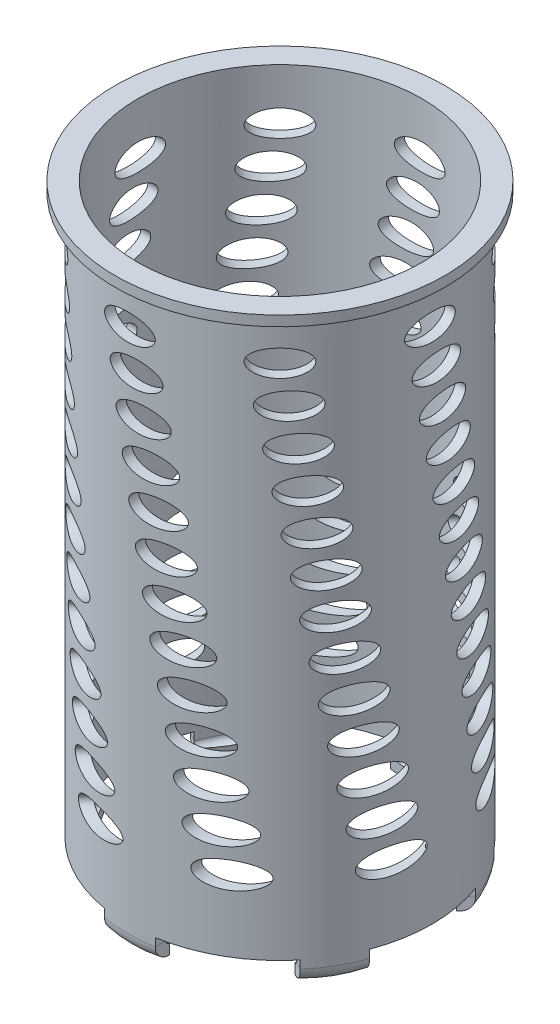
from build123d import *
from build123d.topology import SkipClean

# Parameters (mm, degrees)
CUT_EXTRUDE1_REACH      = 90.565
CUT_EXTRUDE1_END_RADIUS = 17.78
SKETCH3_RX              = 3.175
SKETCH3_RY              = 1.651
CIRPATTERN1_COUNT       = 8
CIRPATTERN2_COUNT       = 6


with BuildPart() as part:
    # Sketch2 → Revolve-Thin1 (revolve)
    with BuildSketch(Plane(origin=(0, 0, 0), x_dir=(0, 0, -1), z_dir=(1, 0, 0)), mode=Mode.PRIVATE) as revolve_thin1_sk:
        Polygon((-19.05, 0), (-19.05, 69.85), (-20.6375, 69.85), (-20.6375, 71.12), (-17.78, 71.12), (-17.78, 0), align=None)
    revolve(revolve_thin1_sk.sketch.rotate(Axis((0, 0, 0), (0, 1, 0)), 180), axis=Axis((0, 0, 0), (0, 1, 0)))

    # Cut-Extrude1: up to this cylinder (the profile starts outside it)
    cut_extrude1_end = Plane(origin=(0, 36.83, 0), z_dir=(0, -1, 0)) * Cylinder(CUT_EXTRUDE1_END_RADIUS, 273.57, mode=Mode.PRIVATE)
    # Sketch3 → Cut-Extrude1 (cut, up to the surface)
    with BuildSketch(Plane.XY.offset(27.94), mode=Mode.PRIVATE) as cut_extrude1_sk1:
        with Locations((0, 64.77)):
            Ellipse(SKETCH3_RX, SKETCH3_RY)
    cut_extrude1_tool1 = extrude(cut_extrude1_sk1.sketch, amount=-CUT_EXTRUDE1_REACH, mode=Mode.PRIVATE) - cut_extrude1_end
    # Sketch3 → Cut-Extrude1 (cut, up to the surface)
    with BuildSketch(Plane.XY.offset(27.94), mode=Mode.PRIVATE) as cut_extrude1_sk2:
        with Locations((0.821095973, 60.113333333)):
            Ellipse(SKETCH3_RX, SKETCH3_RY)
    cut_extrude1_tool2 = extrude(cut_extrude1_sk2.sketch, amount=-CUT_EXTRUDE1_REACH, mode=Mode.PRIVATE) - cut_extrude1_end
    # Sketch3 → Cut-Extrude1 (cut, up to the surface)
    with BuildSketch(Plane.XY.offset(27.94), mode=Mode.PRIVATE) as cut_extrude1_sk3:
        with Locations(Location((1.642191947, 55.456666667), (0, 0, 180))):
            Ellipse(SKETCH3_RX, SKETCH3_RY)
    cut_extrude1_tool3 = extrude(cut_extrude1_sk3.sketch, amount=-CUT_EXTRUDE1_REACH, mode=Mode.PRIVATE) - cut_extrude1_end
    # Sketch3 → Cut-Extrude1 (cut, up to the surface)
    with BuildSketch(Plane.XY.offset(27.94), mode=Mode.PRIVATE) as cut_extrude1_sk4:
        with Locations((2.46328792, 50.8)):
            Ellipse(SKETCH3_RX, SKETCH3_RY)
    cut_extrude1_tool4 = extrude(cut_extrude1_sk4.sketch, amount=-CUT_EXTRUDE1_REACH, mode=Mode.PRIVATE) - cut_extrude1_end
    # Sketch3 → Cut-Extrude1 (cut, up to the surface)
    with BuildSketch(Plane.XY.offset(27.94), mode=Mode.PRIVATE) as cut_extrude1_sk5:
        with Locations((3.284383894, 46.143333333)):
            Ellipse(SKETCH3_RX, SKETCH3_RY)
    cut_extrude1_tool5 = extrude(cut_extrude1_sk5.sketch, amount=-CUT_EXTRUDE1_REACH, mode=Mode.PRIVATE) - cut_extrude1_end
    # Sketch3 → Cut-Extrude1 (cut, up to the surface)
    with BuildSketch(Plane.XY.offset(27.94), mode=Mode.PRIVATE) as cut_extrude1_sk6:
        with Locations((4.105479867, 41.486666667)):
            Ellipse(SKETCH3_RX, SKETCH3_RY)
    cut_extrude1_tool6 = extrude(cut_extrude1_sk6.sketch, amount=-CUT_EXTRUDE1_REACH, mode=Mode.PRIVATE) - cut_extrude1_end
    # Sketch3 → Cut-Extrude1 (cut, up to the surface)
    with BuildSketch(Plane.XY.offset(27.94), mode=Mode.PRIVATE) as cut_extrude1_sk7:
        with Locations((4.926575841, 36.83)):
            Ellipse(SKETCH3_RX, SKETCH3_RY)
    cut_extrude1_tool7 = extrude(cut_extrude1_sk7.sketch, amount=-CUT_EXTRUDE1_REACH, mode=Mode.PRIVATE) - cut_extrude1_end
    # Sketch3 → Cut-Extrude1 (cut, up to the surface)
    with BuildSketch(Plane.XY.offset(27.94), mode=Mode.PRIVATE) as cut_extrude1_sk8:
        with Locations((5.747671814, 32.173333333)):
            Ellipse(SKETCH3_RX, SKETCH3_RY)
    cut_extrude1_tool8 = extrude(cut_extrude1_sk8.sketch, amount=-CUT_EXTRUDE1_REACH, mode=Mode.PRIVATE) - cut_extrude1_end
    # Sketch3 → Cut-Extrude1 (cut, up to the surface)
    with BuildSketch(Plane.XY.offset(27.94), mode=Mode.PRIVATE) as cut_extrude1_sk9:
        with Locations(Location((6.568767788, 27.516666667), (0, 0, 180))):
            Ellipse(SKETCH3_RX, SKETCH3_RY)
    cut_extrude1_tool9 = extrude(cut_extrude1_sk9.sketch, amount=-CUT_EXTRUDE1_REACH, mode=Mode.PRIVATE) - cut_extrude1_end
    # Sketch3 → Cut-Extrude1 (cut, up to the surface)
    with BuildSketch(Plane.XY.offset(27.94), mode=Mode.PRIVATE) as cut_extrude1_sk10:
        with Locations((7.389863761, 22.86)):
            Ellipse(SKETCH3_RX, SKETCH3_RY)
    cut_extrude1_tool10 = extrude(cut_extrude1_sk10.sketch, amount=-CUT_EXTRUDE1_REACH, mode=Mode.PRIVATE) - cut_extrude1_end
    # Sketch3 → Cut-Extrude1 (cut, up to the surface)
    with BuildSketch(Plane.XY.offset(27.94), mode=Mode.PRIVATE) as cut_extrude1_sk11:
        with Locations((8.210959735, 18.203333333)):
            Ellipse(SKETCH3_RX, SKETCH3_RY)
    cut_extrude1_tool11 = extrude(cut_extrude1_sk11.sketch, amount=-CUT_EXTRUDE1_REACH, mode=Mode.PRIVATE) - cut_extrude1_end
    # Sketch3 → Cut-Extrude1 (cut, up to the surface)
    with BuildSketch(Plane.XY.offset(27.94), mode=Mode.PRIVATE) as cut_extrude1_sk12:
        with Locations(Location((9.032055708, 13.546666667), (0, 0, 180))):
            Ellipse(SKETCH3_RX, SKETCH3_RY)
    cut_extrude1_tool12 = extrude(cut_extrude1_sk12.sketch, amount=-CUT_EXTRUDE1_REACH, mode=Mode.PRIVATE) - cut_extrude1_end
    # Sketch3 → Cut-Extrude1 (cut, up to the surface)
    with BuildSketch(Plane.XY.offset(27.94), mode=Mode.PRIVATE) as cut_extrude1_sk13:
        with Locations(Location((9.853151682, 8.89), (0, 0, 180))):
            Ellipse(SKETCH3_RX, SKETCH3_RY)
    cut_extrude1_tool13 = extrude(cut_extrude1_sk13.sketch, amount=-CUT_EXTRUDE1_REACH, mode=Mode.PRIVATE) - cut_extrude1_end
    cut_extrude1 = cut_extrude1_tool1.solids().sort_by_distance((0, 64.77, 27.94))[0] + cut_extrude1_tool2.solids().sort_by_distance((0.821096, 60.113333, 27.94))[0] + cut_extrude1_tool3.solids().sort_by_distance((1.642192, 55.456667, 27.94))[0] + cut_extrude1_tool4.solids().sort_by_distance((2.463288, 50.8, 27.94))[0] + cut_extrude1_tool5.solids().sort_by_distance((3.284384, 46.143333, 27.94))[0] + cut_extrude1_tool6.solids().sort_by_distance((4.10548, 41.486667, 27.94))[0] + cut_extrude1_tool7.solids().sort_by_distance((4.926576, 36.83, 27.94))[0] + cut_extrude1_tool8.solids().sort_by_distance((5.747672, 32.173333, 27.94))[0] + cut_extrude1_tool9.solids().sort_by_distance((6.568768, 27.516667, 27.94))[0] + cut_extrude1_tool10.solids().sort_by_distance((7.389864, 22.86, 27.94))[0] + cut_extrude1_tool11.solids().sort_by_distance((8.21096, 18.203333, 27.94))[0] + cut_extrude1_tool12.solids().sort_by_distance((9.032056, 13.546667, 27.94))[0] + cut_extrude1_tool13.solids().sort_by_distance((9.853152, 8.89, 27.94))[0]
    add(cut_extrude1, mode=Mode.SUBTRACT)

    # CirPattern1: Cut-Extrude1 ×8 about axis
    cirpattern1_axis = Axis((0, 71.12, 0), (0, -1, 0))
    for i in range(1, CIRPATTERN1_COUNT):
        add(cut_extrude1.rotate(cirpattern1_axis, i * 360 / CIRPATTERN1_COUNT), mode=Mode.SUBTRACT)

    # Sweep1: sweep along a path in Sketch12
    with SkipClean():  # the faces are left unmerged after this step: merging them gives an invalid solid
        with BuildLine(Plane(origin=(0, 0, 0), x_dir=(0, 0, -1), z_dir=(1, 0, 0))) as sweep1_path:
            Line((-17.78, 0), (-17.78, -1.016))
            ThreePointArc((-17.78, -1.016), (-17.556815367, -1.554815367), (-17.018, -1.778))
        # Sketch13 → Sweep1 (sweep)
        with BuildSketch(Plane(origin=(0, 0, 17.78), x_dir=(1, 0, 0), z_dir=(0, 1, 0))):
            with BuildLine():
                Line((3.175, 0.285778811), (3.175, -1.003553311))
                ThreePointArc((3.175, -1.003553311), (0, -1.27), (-3.175, -1.003553311))
                Line((-3.175, -1.003553311), (-3.175, 0.285778811))
                ThreePointArc((-3.175, 0.285778811), (0, 0), (3.175, 0.285778811))
            make_face()
        sweep1 = sweep(path=sweep1_path.line)

    # CirPattern2: Sweep1 ×6 about axis
    with SkipClean():  # the faces are left unmerged after this step: merging them gives an invalid solid
        cirpattern2_axis = Axis((0, 0, 0), (0, 1, 0))
        for i in range(1, CIRPATTERN2_COUNT):
            add(sweep1.rotate(cirpattern2_axis, i * 360 / CIRPATTERN2_COUNT))


solid = part.part
